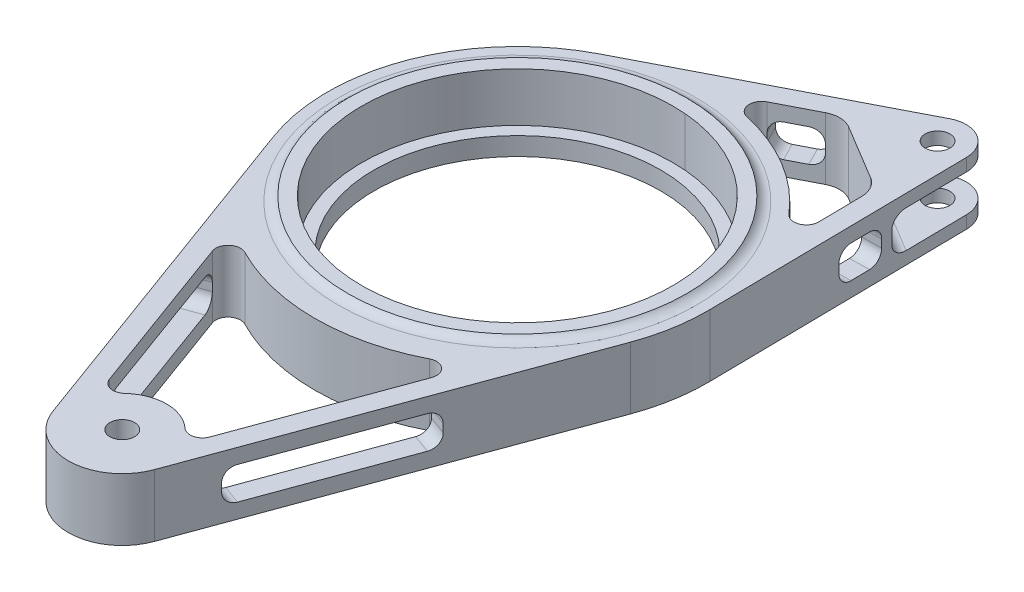
from build123d import *

# Parameters (mm, degrees)
SKETCH1_R           = 36.800037017
SKETCH1_R_2         = 3.175
BOSS_EXTRUDE1_DEPTH = 16.002
SKETCH5_R           = 43.561
SKETCH5_R_2         = 40.000036967
BOSS_EXTRUDE3_DEPTH = 1.27
SKETCH6_R           = 40.000036967
SKETCH6_R_2         = 36.800037017
CUT_EXTRUDE2_DEPTH  = 11.3284
FILLET2_R           = 3.175
CUT_EXTRUDE3_DEPTH  = 4.7625
CUT_EXTRUDE4_DEPTH  = 18.80616
FILLET3_R           = 3.175
FILLET5_R           = 6.35
CUT_EXTRUDE5_REACH  = 140.003
SKETCH22_W          = 44.42320982
SKETCH22_H          = 8.382
CUT_EXTRUDE6_REACH  = 140.003
SKETCH23_W          = 44.42320982
SKETCH23_H          = 8.382
CUT_EXTRUDE7_REACH  = 154.858
SKETCH24_W          = 11.166222722
SKETCH24_H          = 8.382
CUT_EXTRUDE8_REACH  = 177.085
SKETCH25_W          = 11.166222722
SKETCH25_H          = 8.382
FILLET6_R           = 3.175


with BuildPart() as part:
    # Sketch1 → Boss-Extrude1 (new body)
    with BuildSketch(Plane(origin=(0, 0, 0), x_dir=(1, 0, 0), z_dir=(0, 1, 0))):
        with BuildLine():
            Line((-45.845642474, -16.794270915), (-13.030803906, -106.373471135))
            ThreePointArc((-13.030803906, -106.373471135), (0, -115.477603436), (13.030803906, -106.373471135))
            Line((13.030803906, -106.373471135), (45.845642474, -16.794270915))
            ThreePointArc((45.845642474, -16.794270915), (48.13062155, -8.204495023), (48.820472847, 0.657191296))
            Line((48.820472847, 0.657191296), (47.919430717, 67.592500854))
            ThreePointArc((47.919430717, 67.592500854), (44.347868478, 73.807247594), (37.183825898, 74.043103011))
            Line((37.183825898, 74.043103011), (-22.33955821, 43.414451608))
            ThreePointArc((-22.33955821, 43.414451608), (-45.481622278, 17.756477815), (-45.845642474, -16.794270915))
        make_face()
        with Locations(Location((0, 0, 0), (0, 0, 270))):
            Circle(SKETCH1_R, mode=Mode.SUBTRACT)
        with Locations(Location((0, -101.6, 0), (0, 0, 270))):
            Circle(SKETCH1_R_2, mode=Mode.SUBTRACT)
        with Locations(Location((40.554098018, 67.493353257, 0), (0, 0, 270))):
            Circle(SKETCH1_R_2, mode=Mode.SUBTRACT)
    extrude(amount=BOSS_EXTRUDE1_DEPTH)

    # Sketch5 → Boss-Extrude3 (add)
    with BuildSketch(Plane.XZ):
        with Locations(Location((0, 0, 0), (0, 0, 90))):
            Circle(SKETCH5_R)
        with Locations(Location((0, 0, 0), (0, 0, 270))):
            Circle(SKETCH5_R_2, mode=Mode.SUBTRACT)
    extrude(amount=BOSS_EXTRUDE3_DEPTH)

    # Sketch6 → Cut-Extrude2 (cut)
    with BuildSketch(Plane.XZ):
        with Locations(Location((0, 0, 0), (0, 0, 270))):
            Circle(SKETCH6_R)
        with Locations(Location((0, 0, 0), (0, 0, 270))):
            Circle(SKETCH6_R_2, mode=Mode.SUBTRACT)
    extrude(amount=-CUT_EXTRUDE2_DEPTH, mode=Mode.SUBTRACT)

    # Fillet2
    # the kernel refuses this fillet: 3.175 mm, written as the material it adds along each edge
    with BuildSketch(Plane(origin=(0, 0, 0), x_dir=(0, 0, 1), z_dir=(1, 0, 0))) as fillet2_piece_1:
        with BuildLine():
            CenterArc((46.101, 3.175), FILLET2_R, 216.869897646, 53.130102354)
            Line((46.101, 0), (46.101, -0.0635))
            Line((46.101, -0.0635), (43.561, -0.0635))
            Line((43.561, -0.0635), (43.4975, 0))
            ThreePointArc((43.4975, 0), (43.4975, 0.635), (43.5102, 1.2319))
            Line((43.5102, 1.2319), (43.561, 1.27))
        make_face()
    revolve(axis=Axis((0, 0, 0), (0, -1, 0)))

    # Sketch7 → Cut-Extrude3 (cut, symmetric)
    with BuildSketch(Plane(origin=(0, 8.001, 0), x_dir=(-1, 0, 0), z_dir=(0, -1, 0))):
        Polygon((-8.642366299, 86.667856133), (-2.101382747, 75.781831414), (-66.916726186, 36.836844033), (-73.457709737, 47.722868752), (-97.309602446, 87.419084403), (-32.494259008, 126.364071784), align=None)
    extrude(amount=CUT_EXTRUDE3_DEPTH, both=True, mode=Mode.SUBTRACT)


with BuildPart() as body_2:
    # Mirror1: mirrored copy
    add(part.part.mirror(Plane(origin=(0, -1.27, 0), x_dir=(0, 0, 1), z_dir=(0, -1, 0))))

    # Sketch9 → Cut-Extrude4 (cut)
    with BuildSketch(Plane(origin=(0, 0, 0), x_dir=(1, 0, 0), z_dir=(0, 1, 0))):
        with BuildLine():
            Line((22.973751547, 61.018010354), (43.090182322, 48.930839307))
            Line((43.090182322, 48.930839307), (43.428261446, 23.816108157))
            ThreePointArc((43.428261446, 23.816108157), (25.50983585, 42.455496404), (0.640041598, 49.525864422))
            Line((0.640041598, 49.525864422), (22.973751547, 61.018010354))
        make_face()
        with BuildLine():
            Line((-31.360879833, -41.566574505), (-10.770746379, -97.774307586))
            ThreePointArc((-10.770746379, -97.774307586), (0, -90.17), (10.770746379, -97.774307586))
            Line((10.770746379, -97.774307586), (31.360879833, -41.566574505))
            ThreePointArc((31.360879833, -41.566574505), (0, -52.07), (-31.360879833, -41.566574505))
        make_face()
    extrude(amount=-CUT_EXTRUDE4_DEPTH, mode=Mode.SUBTRACT)

    # Fillet3
    fillet3_edges = [body_2.edges().sort_by_distance(p)[0] for p in [
        (0.640041598, -10.541, -49.525864422),
        (43.428261446, -10.541, -23.816108157),
        (-31.360879833, -10.541, 41.566574505),
        (31.360879833, -10.541, 41.566574505),
        (10.770746379, -10.541, 97.774307586),
        (-10.770746379, -10.541, 97.774307586),
        (34.013114467, -15.3035, -56.607328538),
        (34.013114467, -5.7785, -56.607328538),
    ]]
    fillet(fillet3_edges, radius=FILLET3_R)

    # Fillet5
    fillet5_edges = [body_2.edges().sort_by_distance(p)[0] for p in [
        (22.973751547, -10.541, -61.018010354),
        (43.090182322, -10.541, -48.930839307),
    ]]
    fillet(fillet5_edges, radius=FILLET5_R)

    # Sketch22 → Cut-Extrude5 (cut, up to next)
    with BuildSketch(Plane(origin=(45.845642474, 0, 16.794270915), x_dir=(0.34396941500000017, 0, -0.9389808525974094), z_dir=(0.9389808525974093, 0, 0.3439694150000001)), mode=Mode.PRIVATE) as cut_extrude5_sk1:
        with Locations((-59.709519033, -10.541)):
            Rectangle(SKETCH22_W, SKETCH22_H)
    cut_extrude5_tool1 = extrude(cut_extrude5_sk1.sketch, amount=-CUT_EXTRUDE5_REACH, mode=Mode.PRIVATE) & body_2.part
    add(cut_extrude5_tool1.solids().sort_by_distance((25.307394, -10.541, 72.860366))[0], mode=Mode.SUBTRACT)

    # Sketch23 → Cut-Extrude6 (cut, up to next)
    with BuildSketch(Plane(origin=(-45.845642474, 0, 16.794270915), x_dir=(0.3439694150000003, 0, 0.9389808525974093), z_dir=(-0.9389808525974094, 0, 0.34396941500000033)), mode=Mode.PRIVATE) as cut_extrude6_sk1:
        with Locations((59.709519033, -10.541)):
            Rectangle(SKETCH23_W, SKETCH23_H)
    cut_extrude6_tool1 = extrude(cut_extrude6_sk1.sketch, amount=-CUT_EXTRUDE6_REACH, mode=Mode.PRIVATE) & body_2.part
    add(cut_extrude6_tool1.solids().sort_by_distance((-25.307394, -10.541, 72.860366))[0], mode=Mode.SUBTRACT)

    # Sketch24 → Cut-Extrude7 (cut, up to next)
    with BuildSketch(Plane(origin=(48.820472847, 0, -0.657191296), x_dir=(-0.01346016787133038, 0, -0.9999094078369678), z_dir=(0.9999094078369678, 0, -0.01346016787133038)), mode=Mode.PRIVATE) as cut_extrude7_sk1:
        with Locations((39.22684129, -10.541)):
            Rectangle(SKETCH24_W, SKETCH24_H)
    cut_extrude7_tool1 = extrude(cut_extrude7_sk1.sketch, amount=-CUT_EXTRUDE7_REACH, mode=Mode.PRIVATE) & body_2.part
    add(cut_extrude7_tool1.solids().sort_by_distance((48.292473, -10.541, -39.880479))[0], mode=Mode.SUBTRACT)

    # Sketch25 → Cut-Extrude8 (cut, up to next)
    with BuildSketch(Plane(origin=(-22.33955821, 0, -43.414451608), x_dir=(-0.8891867707725541, 0, 0.4575444095200786), z_dir=(-0.4575444095200785, 0, -0.889186770772554)), mode=Mode.PRIVATE) as cut_extrude8_sk1:
        with Locations((-39.22684129, -10.541)):
            Rectangle(SKETCH25_W, SKETCH25_H)
    cut_extrude8_tool1 = extrude(cut_extrude8_sk1.sketch, amount=-CUT_EXTRUDE8_REACH, mode=Mode.PRIVATE) & body_2.part
    add(cut_extrude8_tool1.solids().sort_by_distance((12.54043, -10.541, -61.362474))[0], mode=Mode.SUBTRACT)

    # Fillet6
    fillet6_edges = [body_2.edges().sort_by_distance(p)[0] for p in [
        (15.28227003, -14.732, 92.842955406),
        (15.28227003, -6.35, 92.842955406),
        (30.562495524, -6.35, 51.130411974),
        (30.562495524, -14.732, 51.130411974),
        (-30.562495524, -14.732, 51.130411974),
        (-30.562495524, -6.35, 51.130411974),
        (-15.28227003, -6.35, 92.842955406),
        (-15.28227003, -14.732, 92.842955406),
        (45.827852698, -14.732, -34.263684541),
        (45.827852698, -6.35, -34.263684541),
        (45.677553466, -6.35, -45.428895691),
        (45.677553466, -14.732, -45.428895691),
        (18.667021686, -14.732, -61.658460536),
        (18.667021686, -6.35, -61.658460536),
        (8.738164162, -6.35, -56.549417754),
        (8.738164162, -14.732, -56.549417754),
    ]]
    fillet(fillet6_edges, radius=FILLET6_R)


solid = body_2.part
